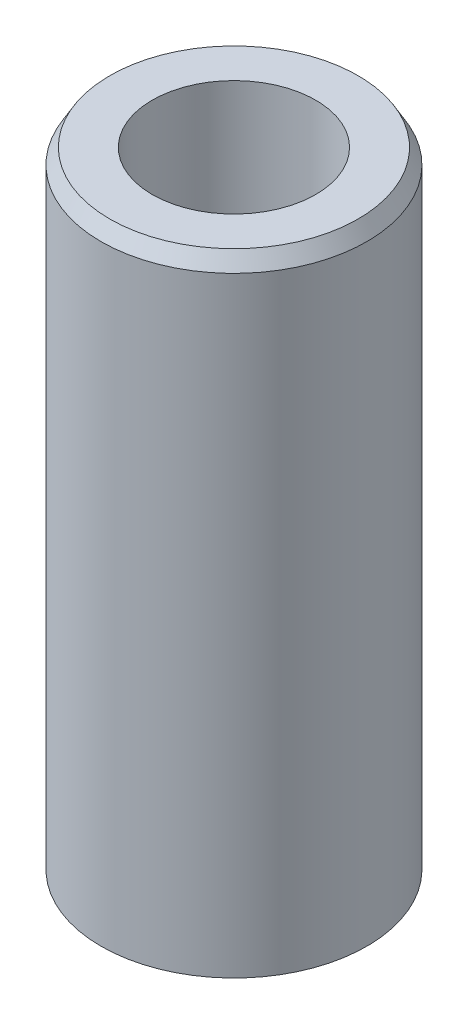
from build123d import *
from OCP.BRepFilletAPI import BRepFilletAPI_MakeChamfer

# Parameters (mm, degrees)
SKETCH1_R           = 12.5
BOSS_EXTRUDE1_DEPTH = 59.629491547
SKETCH2_R           = 7.688605604
CUT_EXTRUDE1_DEPTH  = 63.194664258
CHAMFER1_SIZE       = 1.427016396
CHAMFER1_SIZE2      = 0.8238883


with BuildPart() as part:
    # Sketch1 → Boss-Extrude1 (new body)
    with BuildSketch(Plane(origin=(0, 0, 0), x_dir=(1, 0, 0), z_dir=(0, 1, 0))):
        Circle(SKETCH1_R)
    extrude(amount=BOSS_EXTRUDE1_DEPTH)

    # Sketch2 → Cut-Extrude1 (cut, through all)
    with BuildSketch(Plane(origin=(0, 0, 0), x_dir=(1, 0, 0), z_dir=(0, 1, 0))):
        Circle(SKETCH2_R)
    extrude(amount=CUT_EXTRUDE1_DEPTH, mode=Mode.SUBTRACT)

    # Chamfer1: one chamfer whose edges measure the first distance from different faces: ONE call of the kernel's chamfer builder (chamfer() names one face for all edges)
    chamfer1_edges_1 = [part.edges().sort_by_distance(p)[0] for p in [
        (-12.5, 59.629491547, 0),
    ]]
    chamfer1_side_1 = [part.faces().sort_by_distance(p)[0] for p in [
        (-12.5, 29.814745773, 0),
    ]]
    chamfer1_edges_2 = [part.edges().sort_by_distance(p)[0] for p in [
        (-12.5, 0, 0),
    ]]
    chamfer1_side_2 = [part.faces().sort_by_distance(p)[0] for p in [
        (-12.146446609, 0, 0),
    ]]
    chamfer1 = BRepFilletAPI_MakeChamfer(part.part.solid().wrapped)
    for e in chamfer1_edges_1:
        chamfer1.Add(CHAMFER1_SIZE, CHAMFER1_SIZE2, e.wrapped, chamfer1_side_1[0].wrapped)  # the first distance lies on this face
    for e in chamfer1_edges_2:
        chamfer1.Add(CHAMFER1_SIZE, CHAMFER1_SIZE2, e.wrapped, chamfer1_side_2[0].wrapped)  # the first distance lies on this face
    add(Compound.cast(chamfer1.Shape()), mode=Mode.REPLACE)


solid = part.part
